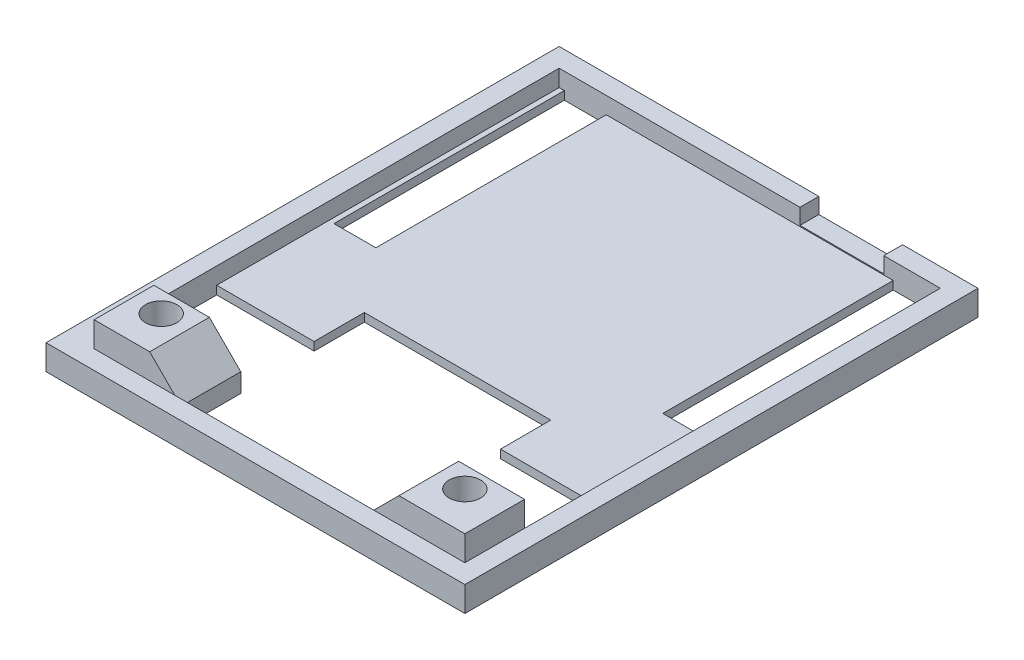
from build123d import *

# Parameters (mm, degrees)
SKETCH1_W           = 40
SKETCH1_H           = 49
BOSS_EXTRUDE1_DEPTH = 2.4
SKETCH2_W           = 36.4
SKETCH2_H           = 45.4
CUT_EXTRUDE1_DEPTH  = 1.6
SKETCH3_W           = 9.3
SKETCH3_H           = 7
SKETCH3_W_2         = 4
SKETCH3_H_2         = 22
CUT_EXTRUDE2_DEPTH  = 1.6
SKETCH4_W           = 9.3
SKETCH4_H           = 5.7
BOSS_EXTRUDE2_DEPTH = 4
SKETCH5_R           = 1.5
CUT_EXTRUDE3_DEPTH  = 5
CHAMFER1_SIZE       = 3
SKETCH6_W           = 8
SKETCH6_H           = 1.8
CUT_EXTRUDE4_DEPTH  = 1.5
SKETCH7_W           = 1
SKETCH7_H           = 5.7
CUT_EXTRUDE5_DEPTH  = 2.4


with BuildPart() as part:
    # Sketch1 → Boss-Extrude1 (new body)
    with BuildSketch(Plane(origin=(0, 0, 0), x_dir=(1, 0, 0), z_dir=(0, 1, 0))):
        Rectangle(SKETCH1_W, SKETCH1_H)
    extrude(amount=BOSS_EXTRUDE1_DEPTH)

    # Sketch2 → Cut-Extrude1 (cut)
    with BuildSketch(Plane(origin=(0, 2.4, 0), x_dir=(1, 0, 0), z_dir=(0, 1, 0))):
        Rectangle(SKETCH2_W, SKETCH2_H)
    extrude(amount=-CUT_EXTRUDE1_DEPTH, mode=Mode.SUBTRACT)

    # Sketch3 → Cut-Extrude2 (cut)
    with BuildSketch(Plane(origin=(0, 0.8, 0), x_dir=(1, 0, 0), z_dir=(0, 1, 0))):
        with Locations((-13.55, -13.5)):
            Rectangle(SKETCH3_W, SKETCH3_H)
        Polygon((8.9, -5.2), (-8.9, -5.2), (-8.9, -10), (-8.9, -17), (-8.9, -22.7), (8.9, -22.7), (8.9, -17), (8.9, -10), align=None)
        with Locations((13.55, -13.5)):
            Rectangle(SKETCH3_W, SKETCH3_H)
        with Locations((15.7, 11.7)):
            Rectangle(SKETCH3_W_2, SKETCH3_H_2)
        with Locations((-15.7, 11.7)):
            Rectangle(SKETCH3_W_2, SKETCH3_H_2)
    extrude(amount=-CUT_EXTRUDE2_DEPTH, mode=Mode.SUBTRACT)

    # Sketch4 → Boss-Extrude2 (add)
    with BuildSketch(Plane(origin=(0, 0.8, 0), x_dir=(1, 0, 0), z_dir=(0, 1, 0))):
        with Locations((-13.55, -19.85)):
            Rectangle(SKETCH4_W, SKETCH4_H)
        with Locations((13.55, -19.85)):
            Rectangle(SKETCH4_W, SKETCH4_H)
    extrude(amount=BOSS_EXTRUDE2_DEPTH)

    # Sketch5 → Cut-Extrude3 (cut)
    with BuildSketch(Plane(origin=(0, 4.8, 0), x_dir=(1, 0, 0), z_dir=(0, 1, 0))):
        with Locations(Location((-14.5, -19, 0), (0, 0, 270))):
            Circle(SKETCH5_R)
        with Locations(Location((14.5, -19, 0), (0, 0, 270))):
            Circle(SKETCH5_R)
    extrude(amount=-CUT_EXTRUDE3_DEPTH, mode=Mode.SUBTRACT)

    # Chamfer1
    # the kernel refuses this chamfer: 3 mm, written as the material it takes off along each edge
    with BuildSketch(Plane(origin=(-8.9, 4.8, 22.7), x_dir=(0.02749587661058793, -0.9996219169112968, 0), z_dir=(0, 0, -1)), Plane(origin=(8.9, 4.8, 9.284951036), x_dir=(-0.027495876610586202, -0.9996219169112968, 0), z_dir=(0, 0, 1))) as chamfer1_piece_1:
        Polygon((CHAMFER1_SIZE * 0.999621916911, CHAMFER1_SIZE * 0.0274958766106), (-CHAMFER1_SIZE * 0.0274958766106, CHAMFER1_SIZE * 0.999621916911), (0, 0), align=None)
    extrude(amount=13.415048964, mode=Mode.SUBTRACT)

    # Sketch6 → Cut-Extrude4 (cut)
    with BuildSketch(Plane(origin=(0, 2.4, 0), x_dir=(1, 0, 0), z_dir=(0, 1, 0))):
        with Locations((8.8, 23.6)):
            Rectangle(SKETCH6_W, SKETCH6_H)
    extrude(amount=-CUT_EXTRUDE4_DEPTH, mode=Mode.SUBTRACT)

    # Sketch7 → Cut-Extrude5 (cut)
    with BuildSketch(Plane(origin=(0, 4.8, 0), x_dir=(1, 0, 0), z_dir=(0, 1, 0))):
        with Locations((-17.7, -19.85)):
            Rectangle(SKETCH7_W, SKETCH7_H)
    extrude(amount=-CUT_EXTRUDE5_DEPTH, mode=Mode.SUBTRACT)


solid = part.part
